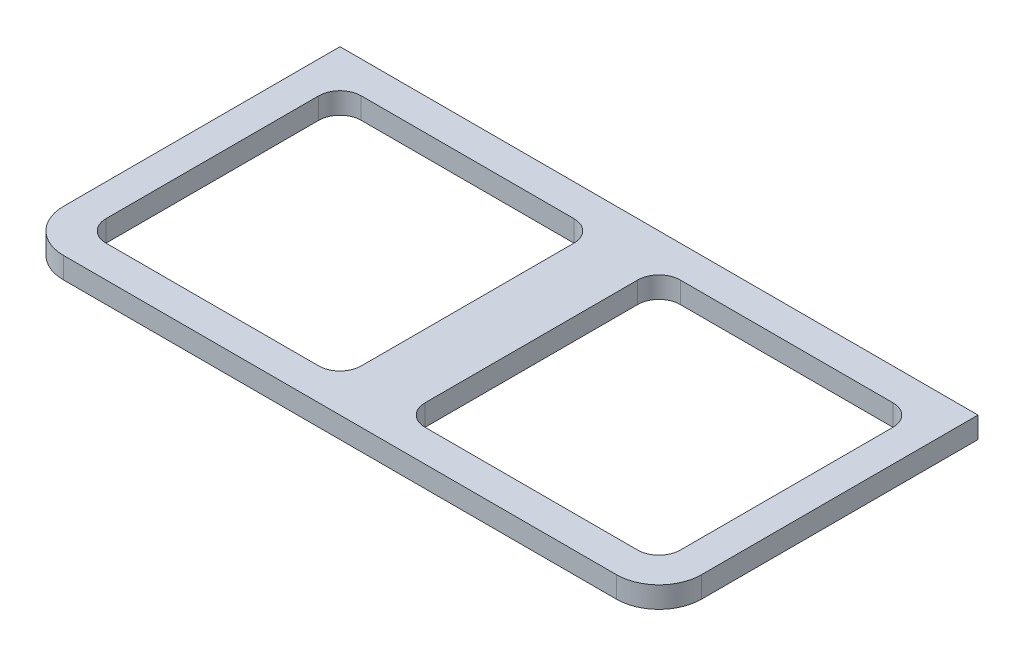
from build123d import *

# Parameters (mm, degrees)
SKIZZE1_W                  = 120
SKIZZE1_H                  = 120
LINEAR_AUSTRAGEN1_DEPTH    = 10
VERRUNDUNG2_R              = 10
VERRUNDUNG2_OF_SPIEGELN1_R = 10


with BuildPart() as part:
    # Skizze1 → Linear austragen1 (new body)
    with BuildSketch(Plane(origin=(0, 10, 0), x_dir=(1, 0, 0), z_dir=(0, 1, 0))):
        with BuildLine():
            Line((0, -75), (130, -75))
            ThreePointArc((130, -75), (144.142135624, -69.142135624), (150, -55))
            Line((150, -55), (150, 75))
            Line((150, 75), (0, 75))
            Line((0, 75), (0, -75))
        make_face()
        with Locations((75, 0)):
            Rectangle(SKIZZE1_W, SKIZZE1_H, mode=Mode.SUBTRACT)
    linear_austragen1 = extrude(amount=LINEAR_AUSTRAGEN1_DEPTH)

    # Verrundung2
    verrundung2_edges = [part.edges().sort_by_distance(p)[0] for p in [
        (15, 15, 60),
        (135, 15, 60),
        (135, 15, -60),
        (15, 15, -60),
    ]]
    fillet(verrundung2_edges, radius=VERRUNDUNG2_R)

    # Spiegeln1: Linear austragen1 across plane
    add(linear_austragen1.mirror(Plane(origin=(0, 20, 75), x_dir=(0, 0, 1), z_dir=(1, 0, 0))))

    # Verrundung2 of Spiegeln1
    verrundung2_of_spiegeln1_edges = [part.edges().sort_by_distance(p)[0] for p in [
        (-15, 15, 60),
        (-135, 15, 60),
        (-135, 15, -60),
        (-15, 15, -60),
    ]]
    fillet(verrundung2_of_spiegeln1_edges, radius=VERRUNDUNG2_OF_SPIEGELN1_R)


solid = part.part
